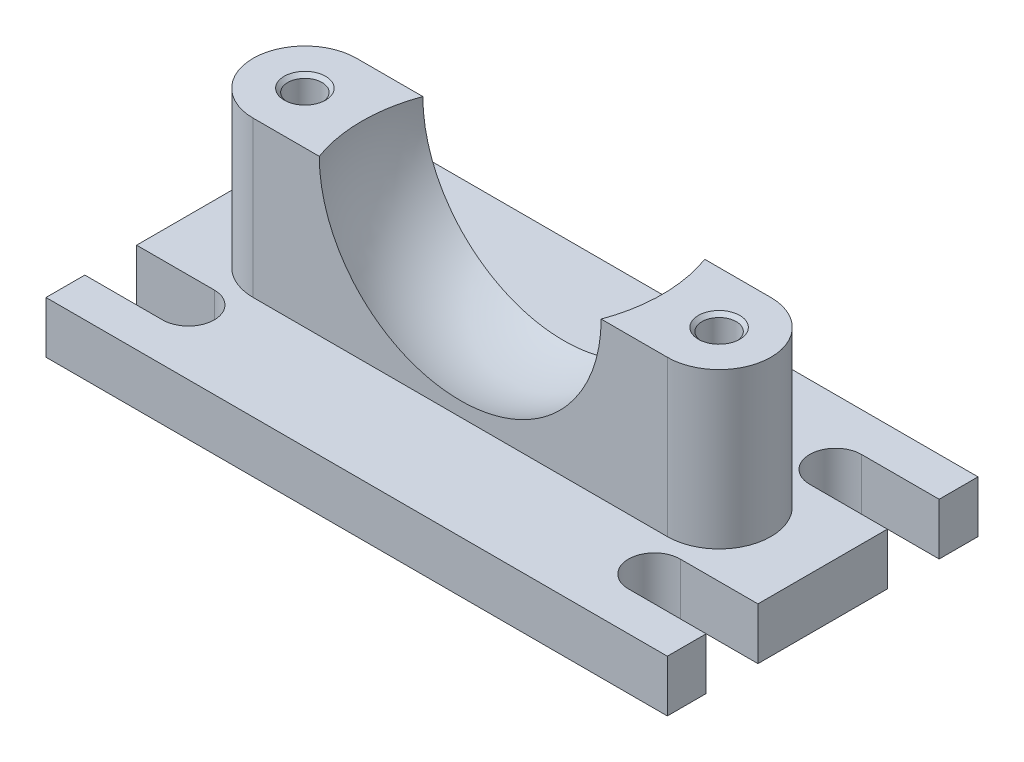
from build123d import *

# Parameters (mm, degrees)
EXTRUDE_2_DEPTH          = 19
EXTRUDE_5_DEPTH          = 40
CUT_EXTRUDE_START        = -10
SKETCH_1_4_R             = 24
CUT_EXTRUDE_1_DEPTH      = 20
SKETCH_4_W               = 120
SKETCH_4_H               = 60
EXTRUDE_6_DEPTH          = 10
FILLET_2_R               = 5
CUT_EXTRUDE_2_DEPTH      = 79.102496759
MIRROR_2_COPY_1_DEPTH    = 79.102496759
CUT_EXTRUDE_3_DEPTH      = 12
SKETCH_6_W               = 25
SKETCH_6_H               = 6
CUT_EXTRUDE_4_DEPTH      = 12
FILLET_3_R               = 4
FILLET_4_R               = 2
SKETCH_7_R               = 3.3095
CUT_EXTRUDE_5_DEPTH      = 25
CHAMFER_1_SIZE           = 3.3
CHAMFER_2_SIZE           = 0.6905
SKETCH_11_W              = 120
SKETCH_11_H              = 68
CUT_EXTRUDE_8_DEPTH      = 80.724525712
CUT_EXTRUDE_9_DEPTH      = 90.493016487
CUT_EXTRUDE_9_DEPTH_BACK = 9
SKETCH_12_W              = 80
SKETCH_12_H              = 30
SKETCH_13_W              = 80
SKETCH_13_H              = 30
CUT_EXTRUDE_10_DEPTH     = 83.462112512


with BuildPart() as part:
    # Эскиз1 → Бобышка-Вытянуть2 (new, symmetric)
    with BuildSketch(Plane.XY):
        with BuildLine():
            Line((35, 0), (26, 0))
            ThreePointArc((26, 0), (0, -26), (-26, 0))
            Line((-26, 0), (-35, 0))
            ThreePointArc((-35, 0), (0, -35), (35, 0))
        make_face()
        with BuildLine():
            Line((26, 0), (24, 0))
            ThreePointArc((24, 0), (0, -24), (-24, 0))
            Line((-24, 0), (-26, 0))
            ThreePointArc((-26, 0), (0, -26), (26, 0))
        make_face()
    extrude(amount=EXTRUDE_2_DEPTH, both=True)

    # Эскиз2 → Бобышка-Вытянуть5 (add)
    with BuildSketch(Plane(origin=(0, 0, 0), x_dir=(1, 0, 0), z_dir=(0, 1, 0))):
        with BuildLine():
            Line((-40, 10), (40, 10))
            ThreePointArc((40, 10), (50, 0), (40, -10))
            Line((40, -10), (-40, -10))
            ThreePointArc((-40, -10), (-50, 0), (-40, 10))
        make_face()
    extrude(amount=-EXTRUDE_5_DEPTH)

    # Эскиз1<4> → Вырез-Вытянуть1 (cut)
    with BuildSketch(Plane.XY.offset(CUT_EXTRUDE_START)):
        Circle(SKETCH_1_4_R)
    extrude(amount=CUT_EXTRUDE_1_DEPTH, mode=Mode.SUBTRACT)

    # Эскиз4 → Бобышка-Вытянуть6 (add)
    with BuildSketch(Plane.XZ.offset(40)):
        Rectangle(SKETCH_4_W, SKETCH_4_H)
    extrude(amount=-EXTRUDE_6_DEPTH)

    # Скругление2
    fillet_2_edges = [part.edges().sort_by_distance(p)[0] for p in [
        (-18.027756377, -30, 14.5),
        (18.027756377, -30, 14.5),
        (18.027756377, -30, -14.5),
        (-18.027756377, -30, -14.5),
    ]]
    fillet(fillet_2_edges, radius=FILLET_2_R)

    # Эскиз5 → Вырез-Вытянуть2 (cut, through all)
    with BuildSketch(Plane.XZ.offset(40)):
        with BuildLine():
            Line((75, -22.5), (45, -22.5))
            ThreePointArc((45, -22.5), (40, -17.5), (45, -12.5))
            Line((45, -12.5), (75, -12.5))
            ThreePointArc((75, -12.5), (80, -17.5), (75, -22.5))
        make_face()
    cut_extrude_2 = extrude(amount=-CUT_EXTRUDE_2_DEPTH, mode=Mode.SUBTRACT)

    # Зеркальное отражение1: Вырез-Вытянуть2 across plane
    add(cut_extrude_2.mirror(Plane.XY), mode=Mode.SUBTRACT)

    # Зеркальное отражение2: Вырез-Вытянуть2 across plane
    add(cut_extrude_2.mirror(Plane(origin=(0, 0, 0), x_dir=(0, 0, 1), z_dir=(1, 0, 0))), mode=Mode.SUBTRACT)

    # Зеркальное отражение2 copy 1 sketch → Зеркальное отражение2 copy 1 (cut, through all)
    with BuildSketch(Plane(origin=(0, -40, 0), x_dir=(-1, 0, 0), z_dir=(0, -1, 0))):
        with BuildLine():
            Line((75, -22.5), (45, -22.5))
            ThreePointArc((45, -22.5), (40, -17.5), (45, -12.5))
            Line((45, -12.5), (75, -12.5))
            ThreePointArc((75, -12.5), (80, -17.5), (75, -22.5))
        make_face()
    extrude(amount=-MIRROR_2_COPY_1_DEPTH, mode=Mode.SUBTRACT)

    # Эскиз1<5> → Вырез-Вытянуть3 (cut, symmetric)
    with BuildSketch(Plane.XY):
        with BuildLine():
            ThreePointArc((-24, 0), (0, 24), (24, 0))
            Line((24, 0), (26, 0))
            ThreePointArc((26, 0), (0, 26), (-26, 0))
            Line((-26, 0), (-24, 0))
        make_face()
        with BuildLine():
            Line((26, 0), (24, 0))
            ThreePointArc((24, 0), (0, -24), (-24, 0))
            Line((-24, 0), (-26, 0))
            ThreePointArc((-26, 0), (0, -26), (26, 0))
        make_face()
    extrude(amount=CUT_EXTRUDE_3_DEPTH, both=True, mode=Mode.SUBTRACT)

    # Эскиз6 → Вырез-Вытянуть4 (cut, symmetric)
    with BuildSketch(Plane.XY):
        with Locations((12.5, -37)):
            Rectangle(SKETCH_6_W, SKETCH_6_H)
    cut_extrude_4 = extrude(amount=CUT_EXTRUDE_4_DEPTH, both=True, mode=Mode.SUBTRACT)

    # Зеркальное отражение3: Вырез-Вытянуть4 across plane
    add(cut_extrude_4.mirror(Plane(origin=(0, -34, -12), x_dir=(0, 0, 1), z_dir=(-1, 0, 0))), mode=Mode.SUBTRACT)

    # Скругление3
    fillet_3_edges = [part.edges().sort_by_distance(p)[0] for p in [
        (25, -34, 0),
        (-25, -34, 0),
    ]]
    fillet(fillet_3_edges, radius=FILLET_3_R)

    # Скругление4
    fillet_4_edges = [part.edges().sort_by_distance(p)[0] for p in [
        (-23.828427125, -35.171572875, 12),
        (23.828427125, -35.171572875, 12),
        (-23.828427125, -35.171572875, -12),
        (23.828427125, -35.171572875, -12),
        (0, -34, 12),
        (0, -34, -12),
        (0, -40, 12),
        (-25, -40, 0),
        (25, -40, 0),
        (0, -40, -12),
    ]]
    fillet(fillet_4_edges, radius=FILLET_4_R - 0.0001)  # a hair under: the kernel refuses the full size

    # Эскиз7 → Вырез-Вытянуть5 (cut)
    with BuildSketch(Plane(origin=(0, 0, 0), x_dir=(1, 0, 0), z_dir=(0, 1, 0))):
        with Locations(Location((-40, 0, 0), (0, 0, 270))):
            Circle(SKETCH_7_R)
        with Locations(Location((40, 0, 0), (0, 0, 270))):
            Circle(SKETCH_7_R)
    extrude(amount=-CUT_EXTRUDE_5_DEPTH, mode=Mode.SUBTRACT)

    # Фаска1
    chamfer_1_edges = [part.edges().sort_by_distance(p)[0] for p in [
        (-40, -25, -3.3095),
        (40, -25, -3.3095),
    ]]
    chamfer(chamfer_1_edges, length=CHAMFER_1_SIZE)

    # Фаска2
    chamfer_2_edges = [part.edges().sort_by_distance(p)[0] for p in [
        (-40, 0, -3.3095),
        (40, 0, -3.3095),
    ]]
    chamfer(chamfer_2_edges, length=CHAMFER_2_SIZE)

    # Эскиз8 → Повернуть1 (revolve)
    with BuildSketch(Plane.XY):
        with BuildLine():
            Line((0, 34), (0, -34))
            ThreePointArc((0, -34), (-34, 0), (0, 34))
        make_face()
    revolve(axis=Axis((0, 0, 0), (0, 1, 0)))

    # Эскиз9 → Вырез-Повернуть1 (revolve, cut)
    with BuildSketch(Plane.XY):
        with BuildLine():
            Line((0, 29), (0, -29))
            ThreePointArc((0, -29), (-29, 0), (0, 29))
        make_face()
    revolve(axis=Axis((0, 0, 0), (0, 1, 0)), mode=Mode.SUBTRACT)

    # Эскиз11 → Вырез-Вытянуть8 (cut, through all)
    with BuildSketch(Plane(origin=(0, 0, 0), x_dir=(1, 0, 0), z_dir=(0, 1, 0))):
        Rectangle(SKETCH_11_W, SKETCH_11_H)
    extrude(amount=CUT_EXTRUDE_8_DEPTH, mode=Mode.SUBTRACT)

    # Эскиз12 → Вырез-Вытянуть9 (cut, two sides: drawn at the far end of the back side and taken through both)
    with BuildSketch(Plane.XY.offset(19).offset(-CUT_EXTRUDE_9_DEPTH_BACK)):
        with Locations((0, -15)):
            Rectangle(SKETCH_12_W, SKETCH_12_H)
    extrude(amount=CUT_EXTRUDE_9_DEPTH + CUT_EXTRUDE_9_DEPTH_BACK, mode=Mode.SUBTRACT)

    # Эскиз13 → Вырез-Вытянуть10 (cut, through all)
    with BuildSketch(Plane(origin=(0, 0, -10), x_dir=(-1, 0, 0), z_dir=(0, 0, -1))):
        with Locations((0, -15)):
            Rectangle(SKETCH_13_W, SKETCH_13_H)
    extrude(amount=CUT_EXTRUDE_10_DEPTH, mode=Mode.SUBTRACT)


solid = part.part
